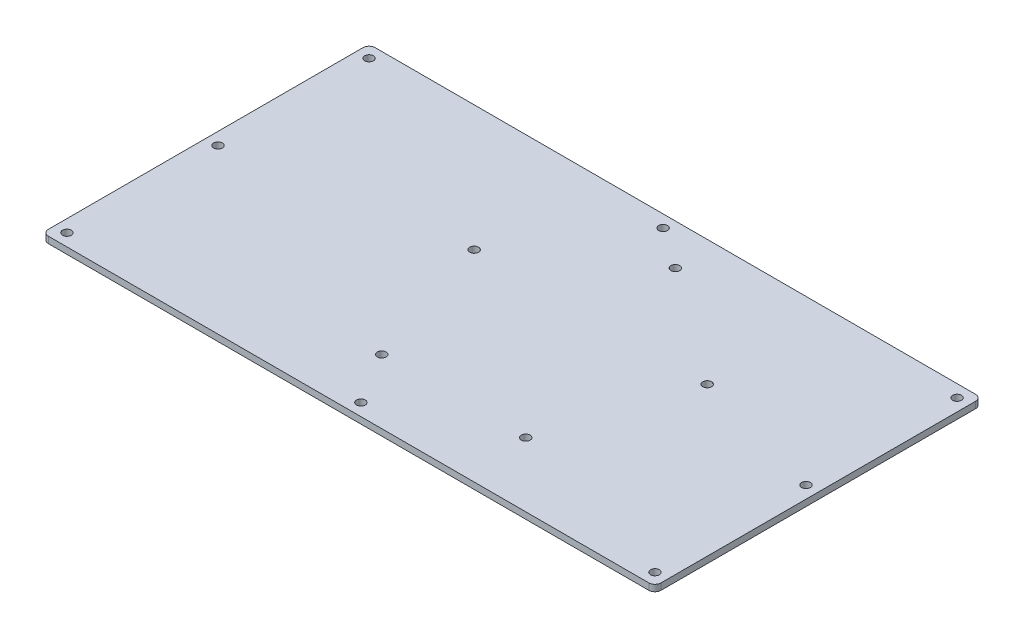
from build123d import *

# Parameters (mm, degrees)
SKETCH2_W           = 300
SKETCH2_H           = 160
SKETCH2_R           = 2.15
BOSS_EXTRUDE2_DEPTH = 3.175
FILLET1_R           = 3


with BuildPart() as part:
    # Sketch2 → Boss-Extrude2 (new body)
    with BuildSketch(Plane(origin=(0, 0, 0), x_dir=(1, 0, 0), z_dir=(0, 1, 0))):
        with Locations((150, 80)):
            Rectangle(SKETCH2_W, SKETCH2_H)
        with Locations((170, 140)):
            Circle(SKETCH2_R, mode=Mode.SUBTRACT)
        with Locations((227.063390978, 98.541019662)):
            Circle(SKETCH2_R, mode=Mode.SUBTRACT)
        with Locations((205.267115138, 31.458980338)):
            Circle(SKETCH2_R, mode=Mode.SUBTRACT)
        with Locations((134.732884862, 31.458980338)):
            Circle(SKETCH2_R, mode=Mode.SUBTRACT)
        with Locations((112.936609022, 98.541019662)):
            Circle(SKETCH2_R, mode=Mode.SUBTRACT)
        with Locations((6, 6)):
            Circle(SKETCH2_R, mode=Mode.SUBTRACT)
        with Locations((294, 6)):
            Circle(SKETCH2_R, mode=Mode.SUBTRACT)
        with Locations((294, 154)):
            Circle(SKETCH2_R, mode=Mode.SUBTRACT)
        with Locations((6, 154)):
            Circle(SKETCH2_R, mode=Mode.SUBTRACT)
        with Locations((150, 6)):
            Circle(SKETCH2_R, mode=Mode.SUBTRACT)
        with Locations((6, 80)):
            Circle(SKETCH2_R, mode=Mode.SUBTRACT)
        with Locations((294, 80)):
            Circle(SKETCH2_R, mode=Mode.SUBTRACT)
        with Locations((150, 154)):
            Circle(SKETCH2_R, mode=Mode.SUBTRACT)
    extrude(amount=BOSS_EXTRUDE2_DEPTH)

    # Fillet1
    fillet1_edges = [part.edges().sort_by_distance(p)[0] for p in [
        (0, 1.5875, 0),
        (300, 1.5875, 0),
        (300, 1.5875, -160),
        (0, 1.5875, -160),
    ]]
    fillet(fillet1_edges, radius=FILLET1_R)


solid = part.part
